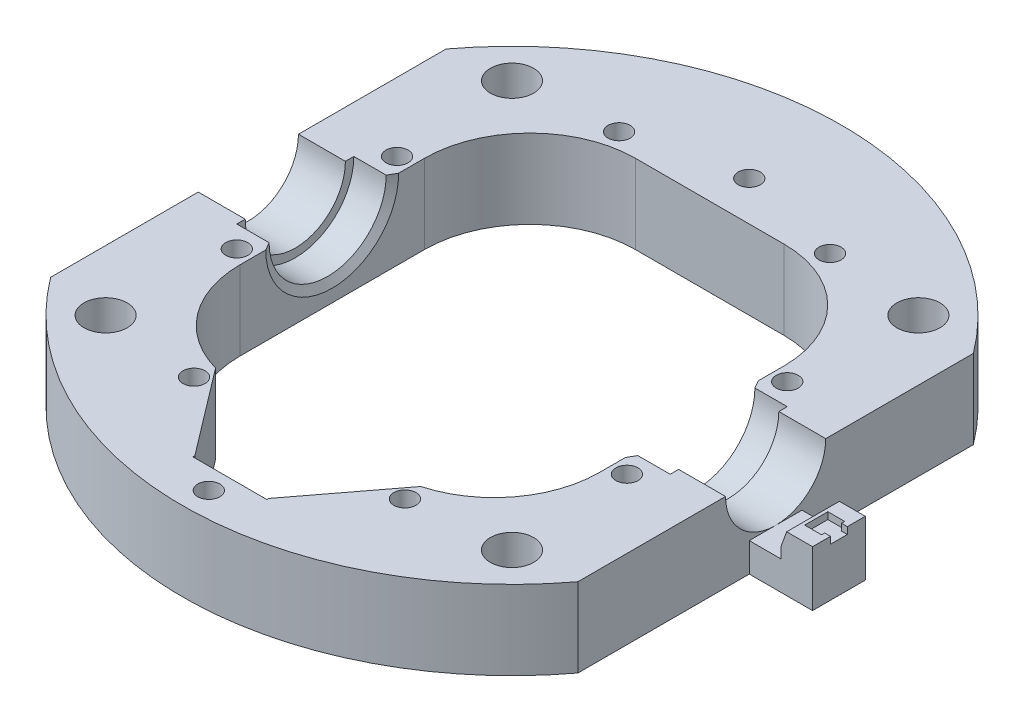
from build123d import *
from OCP.BRepFilletAPI import BRepFilletAPI_MakeChamfer

# Parameters (mm, degrees)
SKETCH2_R               = 62.5
SKETCH2_W               = 68.2
SKETCH2_H               = 75
BOSS_EXTRUDE1_DEPTH     = 15
SKETCH7_W               = 7
SKETCH7_H               = 11.1
CUT_EXTRUDE1_DEPTH      = 122.918866465
CUT_EXTRUDE1_DEPTH_BACK = 122.918866465
SKETCH8_R               = 9.5
FILLET1_R               = 20
SKETCH9_R               = 2.1
CUT_EXTRUDE2_DEPTH      = 90.652105542
CHAMFER1_SIZE           = 1.5
CHAMFER1_SIZE2          = 0.866025404
SKETCH10_R              = 4.1
CUT_EXTRUDE3_DEPTH      = 90.652105542
CUT_EXTRUDE4_DEPTH      = 90.652105542
SKETCH12_W              = 10
SKETCH12_H              = 5.5
BOSS_EXTRUDE2_DEPTH     = 12
BOSS_EXTRUDE3_START     = 6
SKETCH14_W              = 10
SKETCH14_H              = 3.7
BOSS_EXTRUDE3_DEPTH     = 6
BOSS_EXTRUDE4_DEPTH     = 1.3
CHAMFER2_SIZE           = 3
CHAMFER2_SIZE2          = 1.091910703
SKETCH16_W              = 14
SKETCH16_H              = 16
CUT_EXTRUDE5_DEPTH      = 90.652105542
CHAMFER3_DEPTH          = 15
CUT_EXTRUDE6_DEPTH      = 90.652105542


with BuildPart() as part:
    # Sketch2 → Boss-Extrude1 (new body)
    with BuildSketch(Plane(origin=(0, 0, 0), x_dir=(1, 0, 0), z_dir=(0, 1, 0))):
        with Locations(Location((0, 0, 0), (0, 0, 270))):
            Circle(SKETCH2_R)
        Rectangle(SKETCH2_W, SKETCH2_H, mode=Mode.SUBTRACT)
    extrude(amount=BOSS_EXTRUDE1_DEPTH)

    # Sketch7 → Cut-Revolve2 (revolve, cut)
    with BuildSketch(Plane(origin=(0, 15, 0), x_dir=(1, 0, 0), z_dir=(0, 1, 0))):
        with Locations((-37.6, 5.55)):
            Rectangle(SKETCH7_W, SKETCH7_H)
        with Locations((37.6, 5.55)):
            Rectangle(SKETCH7_W, SKETCH7_H)
    revolve(axis=Axis((62.5, 15, 0), (-1, 0, 0)), mode=Mode.SUBTRACT)

    # Sketch8 → Cut-Extrude1 (cut, two sides: drawn at the far end of the back side and taken through both)
    with BuildSketch(Plane.ZY.offset(-41.1).offset(-CUT_EXTRUDE1_DEPTH_BACK)):
        with Locations((0, 15)):
            Circle(SKETCH8_R)
    extrude(amount=CUT_EXTRUDE1_DEPTH + CUT_EXTRUDE1_DEPTH_BACK, mode=Mode.SUBTRACT)

    # Fillet1
    fillet1_edges = [part.edges().sort_by_distance(p)[0] for p in [
        (-34.1, 7.5, -37.5),
        (-34.1, 7.5, 37.5),
        (34.1, 7.5, 37.5),
        (34.1, 7.5, -37.5),
    ]]
    fillet(fillet1_edges, radius=FILLET1_R)

    # Sketch9 → Cut-Extrude2 (cut, through all)
    with BuildSketch(Plane(origin=(0, 15, 0), x_dir=(1, 0, 0), z_dir=(0, 1, 0))):
        with Locations(Location((-37, 15.198684154, 0), (0, 0, 270))):
            Circle(SKETCH9_R)
        with Locations(Location((37, 15.198684154, 0), (0, 0, 270))):
            Circle(SKETCH9_R)
        with Locations(Location((37, -15.198684154, 0), (0, 0, 270))):
            Circle(SKETCH9_R)
        with Locations(Location((-37, -15.198684154, 0), (0, 0, 270))):
            Circle(SKETCH9_R)
        with Locations(Location((-20, 40.311288741, 0), (0, 0, 270))):
            Circle(SKETCH9_R)
        with Locations(Location((20, 40.311288741, 0), (0, 0, 270))):
            Circle(SKETCH9_R)
        with Locations(Location((20, -40.311288741, 0), (0, 0, 270))):
            Circle(SKETCH9_R)
        with Locations(Location((-20, -40.311288741, 0), (0, 0, 270))):
            Circle(SKETCH9_R)
        with Locations(Location((0, 45, 0), (0, 0, 270))):
            Circle(SKETCH9_R)
        with Locations(Location((0, -57.5, 0), (0, 0, 270))):
            Circle(SKETCH9_R)
    extrude(amount=-CUT_EXTRUDE2_DEPTH, mode=Mode.SUBTRACT)

    # Chamfer1: one chamfer whose edges measure the first distance from different faces: ONE call of the kernel's chamfer builder (chamfer() names one face for all edges)
    chamfer1_edges_1 = [part.edges().sort_by_distance(p)[0] for p in [
        (-34.1, 3.9, 0),
    ]]
    chamfer1_side_1 = [part.faces().sort_by_distance(p)[0] for p in [
        (-34.1, 0.380788655, 0),
    ]]
    chamfer1_edges_2 = [part.edges().sort_by_distance(p)[0] for p in [
        (34.1, 3.9, 0),
    ]]
    chamfer1_side_2 = [part.faces().sort_by_distance(p)[0] for p in [
        (34.1, 0.380788655, 0),
    ]]
    chamfer1 = BRepFilletAPI_MakeChamfer(part.part.solid().wrapped)
    for e in chamfer1_edges_1:
        chamfer1.Add(CHAMFER1_SIZE, CHAMFER1_SIZE2, e.wrapped, chamfer1_side_1[0].wrapped)  # the first distance lies on this face
    for e in chamfer1_edges_2:
        chamfer1.Add(CHAMFER1_SIZE, CHAMFER1_SIZE2, e.wrapped, chamfer1_side_2[0].wrapped)  # the first distance lies on this face
    add(Compound.cast(chamfer1.Shape()), mode=Mode.REPLACE)

    # Sketch10 → Cut-Extrude3 (cut, through all)
    with BuildSketch(Plane.XZ):
        with Locations(Location((38.537319575, -38.537319575, 0), (0, 0, 270))):
            Circle(SKETCH10_R)
        with Locations(Location((-38.537319575, -38.537319575, 0), (0, 0, 270))):
            Circle(SKETCH10_R)
        with Locations(Location((-38.537319575, 38.537319575, 0), (0, 0, 270))):
            Circle(SKETCH10_R)
        with Locations(Location((38.537319575, 38.537319575, 0), (0, 0, 270))):
            Circle(SKETCH10_R)
    extrude(amount=-CUT_EXTRUDE3_DEPTH, mode=Mode.SUBTRACT)

    # Sketch11 → Cut-Extrude4 (cut, through all)
    with BuildSketch(Plane.XZ):
        with BuildLine():
            Line((50, -37.5), (50, 37.5))
            ThreePointArc((50, 37.5), (62.5, 0), (50, -37.5))
        make_face()
    extrude(amount=-CUT_EXTRUDE4_DEPTH, mode=Mode.SUBTRACT)

    # Sketch12 → Boss-Extrude2 (add)
    with BuildSketch(Plane(origin=(50, 0, 0), x_dir=(0, 0, -1), z_dir=(1, 0, 0))):
        with Locations((0, 2.75)):
            Rectangle(SKETCH12_W, SKETCH12_H)
    extrude(amount=BOSS_EXTRUDE2_DEPTH)

    # Sketch14 → Boss-Extrude3 (add)
    with BuildSketch(Plane(origin=(50, 0, 0), x_dir=(0, 0, -1), z_dir=(1, 0, 0)).offset(BOSS_EXTRUDE3_START)):
        with Locations((0, 7.35)):
            Rectangle(SKETCH14_W, SKETCH14_H)
    extrude(amount=BOSS_EXTRUDE3_DEPTH)

    # Sketch15 → Boss-Extrude4 (add)
    with BuildSketch(Plane(origin=(0, 9.2, 0), x_dir=(1, 0, 0), z_dir=(0, 1, 0))):
        Polygon((60.9, -2.2), (60.9, -1.6), (62, -1.6), (62, -5), (56, -5), (56, 5), (62, 5), (62, 1.6), (60.9, 1.6), (60.9, 2.2), (57.7, 2.2), (57.7, -2.2), align=None)
    extrude(amount=BOSS_EXTRUDE4_DEPTH)

    # Chamfer2
    chamfer2_edges = [part.edges().sort_by_distance(p)[0] for p in [
        (56, 10.5, 0),
    ]]
    chamfer2_side = [part.faces().sort_by_distance(p)[0] for p in [
        (56, 8, 0),
    ]]
    chamfer(chamfer2_edges, length=CHAMFER2_SIZE, length2=CHAMFER2_SIZE2, reference=chamfer2_side[0])

    # Sketch16 → Cut-Extrude5 (cut, through all)
    with BuildSketch(Plane.XZ):
        with Locations((0, 45.5)):
            Rectangle(SKETCH16_W, SKETCH16_H)
    extrude(amount=-CUT_EXTRUDE5_DEPTH, mode=Mode.SUBTRACT)

    # Chamfer3: read off the stored shape, not the designer's step
    # Chamfer3 outline → Chamfer3 (cut)
    with BuildSketch(Plane(origin=(0, 0, 0), x_dir=(1, 0, 0), z_dir=(0, 1, 0))):
        with BuildLine():
            Line((7, -53.150946691), (19.451351351, -36.770781996))
            ThreePointArc((19.451351351, -36.770781996), (16.800403682, -37.316856965), (14.1, -37.5))
            Line((14.1, -37.5), (7, -37.5))
            Line((7, -37.5), (7, -53.150946691))
        make_face()
        with BuildLine():
            ThreePointArc((-14.1, -37.5), (-16.800403682, -37.316856965), (-19.451351351, -36.770781996))
            Line((-19.451351351, -36.770781996), (-7, -53.150946691))
            Line((-7, -53.150946691), (-7, -37.5))
            Line((-7, -37.5), (-14.1, -37.5))
        make_face()
    extrude(amount=CHAMFER3_DEPTH, mode=Mode.SUBTRACT)

    # Sketch18 → Cut-Extrude6 (cut, through all)
    with BuildSketch(Plane.XZ):
        with BuildLine():
            Line((-50, 37.5), (-50, -37.5))
            ThreePointArc((-50, -37.5), (-62.5, 0), (-50, 37.5))
        make_face()
    extrude(amount=-CUT_EXTRUDE6_DEPTH, mode=Mode.SUBTRACT)


solid = part.part
